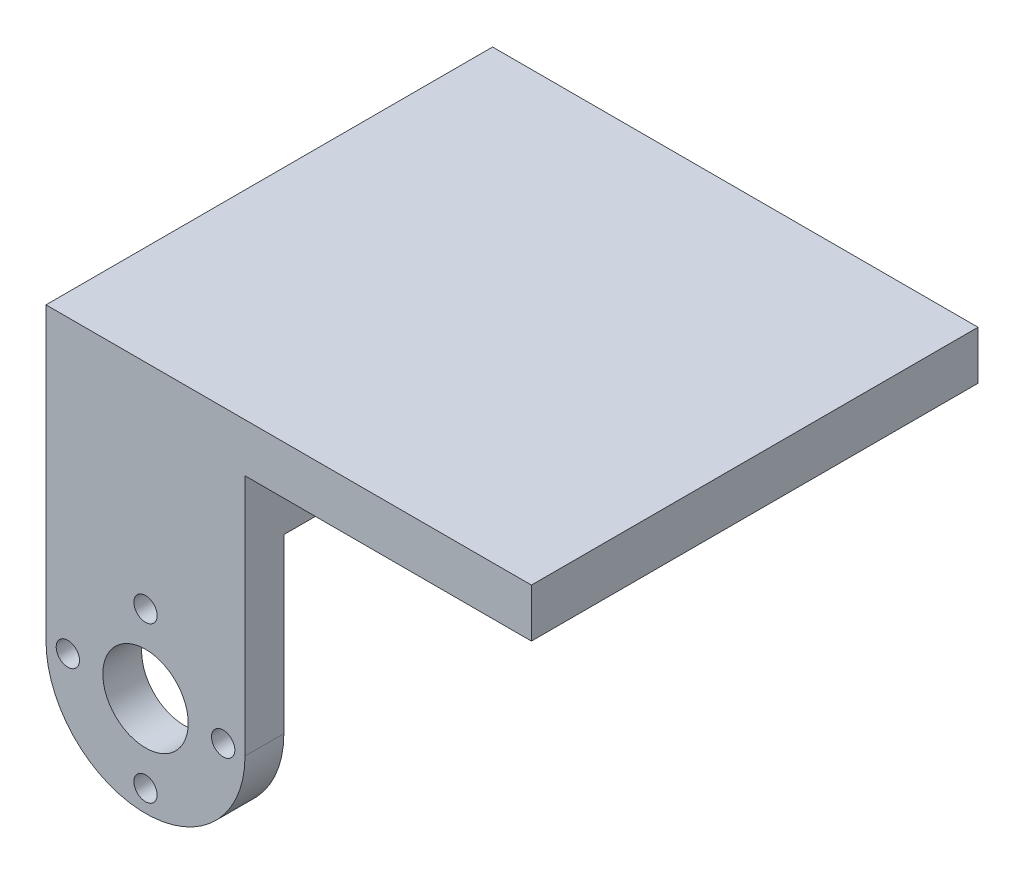
from build123d import *

# Parameters (mm, degrees)
SKETCH1_R           = 1.2
SKETCH1_R_2         = 4.4
BOSS_EXTRUDE1_DEPTH = 46
SKETCH2_W           = 38
SKETCH2_H           = 28
CUT_EXTRUDE1_DEPTH  = 46


with BuildPart() as part:
    # Sketch1 → Boss-Extrude1 (new body)
    with BuildSketch(Plane.XY):
        with BuildLine():
            ThreePointArc((-10.25, 0), (0, -10.25), (10.25, 0))
            Line((10.25, 0), (10.25, 25))
            Line((10.25, 25), (39.75, 25))
            Line((39.75, 25), (39.75, 30))
            Line((39.75, 30), (-10.25, 30))
            Line((-10.25, 30), (-10.25, 0))
        make_face()
        with Locations((-8, 0)):
            Circle(SKETCH1_R, mode=Mode.SUBTRACT)
        with Locations((0, -8)):
            Circle(SKETCH1_R, mode=Mode.SUBTRACT)
        with Locations((8, 0)):
            Circle(SKETCH1_R, mode=Mode.SUBTRACT)
        with Locations((0, 8)):
            Circle(SKETCH1_R, mode=Mode.SUBTRACT)
        Circle(SKETCH1_R_2, mode=Mode.SUBTRACT)
    extrude(amount=-BOSS_EXTRUDE1_DEPTH)

    # Sketch2 → Cut-Extrude1 (cut)
    with BuildSketch(Plane.ZY.offset(10.25)):
        with Locations((-23, 3.75)):
            Rectangle(SKETCH2_W, SKETCH2_H)
    extrude(amount=-CUT_EXTRUDE1_DEPTH, mode=Mode.SUBTRACT)


solid = part.part
